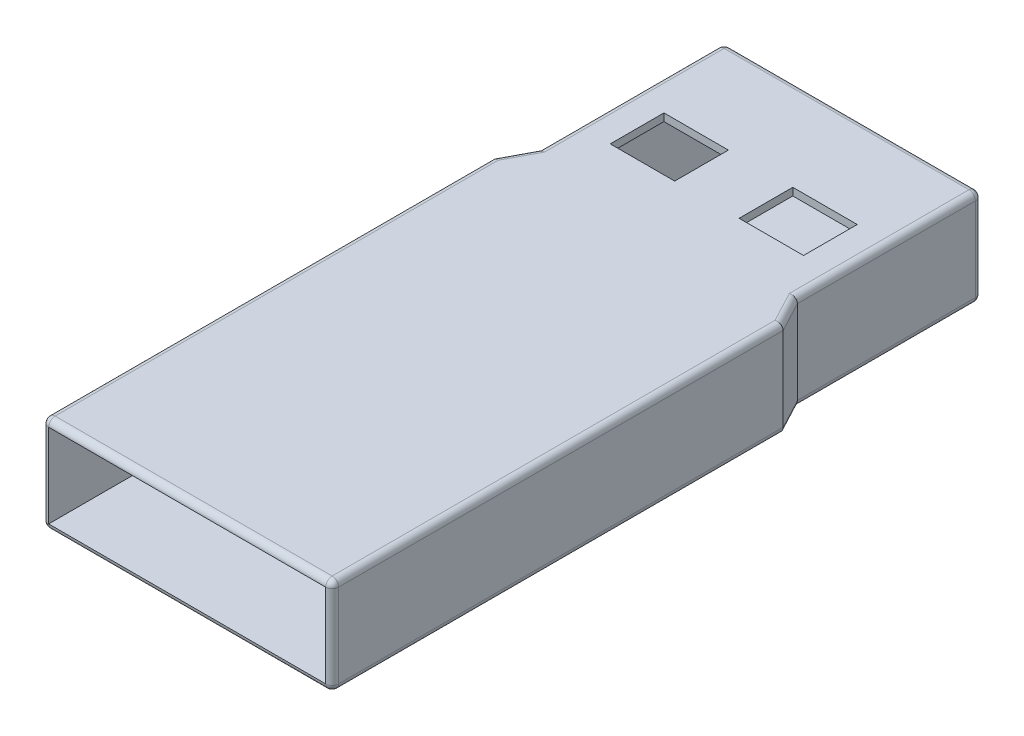
from build123d import *

# Parameters (mm, degrees)
BOSS_EXTRUDE1_DEPTH = 4.5
FILLET1_R           = 0.3
FILLET2_R           = 0.3
SHELL3_START        = 0.35
SHELL3_DEPTH        = 3.8
SKETCH3_W           = 12.9
SKETCH3_H           = 3.9
CUT_EXTRUDE1_DEPTH  = 21
CUT_EXTRUDE2_REACH  = 27.289
SKETCH4_W           = 3
SKETCH4_H           = 2.5


# Read off the part's stored shape, not the designer's step: Shell3
with BuildPart() as part:
    # Sketch1 → Boss-Extrude1 (new body)
    with BuildSketch(Plane(origin=(0, 0, 0), x_dir=(1, 0, 0), z_dir=(0, 1, 0))):
        Polygon((-6.75, -7.047619048), (6.75, -7.047619048), (6.75, 13.952380952), (6, 15.365710355), (6, 23.952380952), (-6, 23.952380952), (-6, 15.365710355), (-6.75, 13.952380952), align=None)
    extrude(amount=BOSS_EXTRUDE1_DEPTH)

    # Fillet1
    fillet1_edges = [part.edges().sort_by_distance(p)[0] for p in [
        (6, 4.5, -19.659045654),
        (6.375, 0, -14.659045654),
        (6.75, 0, -3.452380952),
        (0, 4.5, -23.952380952),
        (-6, 4.5, -19.659045654),
        (-6.375, 4.5, -14.659045654),
        (-6.75, 4.5, -3.452380952),
        (0, 4.5, 7.047619048),
        (6.75, 4.5, -3.452380952),
        (6.375, 4.5, -14.659045654),
        (0, 0, 7.047619048),
        (-6.75, 0, -3.452380952),
        (-6.375, 0, -14.659045654),
        (-6, 0, -19.659045654),
        (0, 0, -23.952380952),
        (6, 0, -19.659045654),
    ]]
    fillet(fillet1_edges, radius=FILLET1_R)

    # Fillet2
    # the kernel refuses this fillet: 0.3 mm, written as the material it takes off along each edge
    with BuildSketch(Plane(origin=(-6.45, 0.3, 6.747619048), x_dir=(-1, 0, 0), z_dir=(0, 0, 1))) as fillet2_piece_1_section:
        Polygon((0, 0), (FILLET2_R, 0), (FILLET2_R, FILLET2_R), (0, FILLET2_R), align=None)
    fillet2_piece_1 = extrude(amount=FILLET2_R, mode=Mode.PRIVATE)
    fillet2_piece_1 = fillet2_piece_1 - Plane(origin=(-6.45, 0.3, 6.747619048), x_dir=(0.7071067811865475, 0.7071067811865475, 0), z_dir=(0, 0, 1)) * Sphere(FILLET2_R, mode=Mode.PRIVATE)
    add(fillet2_piece_1, mode=Mode.SUBTRACT)
    with BuildSketch(Plane(origin=(-5.7, 0.3, -23.652380952), x_dir=(0, 0, -1), z_dir=(-1, 0, 0))) as fillet2_piece_2_section:
        Polygon((0, 0), (FILLET2_R, 0), (FILLET2_R, FILLET2_R), (0, FILLET2_R), align=None)
    fillet2_piece_2 = extrude(amount=FILLET2_R, mode=Mode.PRIVATE)
    fillet2_piece_2 = fillet2_piece_2 - Plane(origin=(-5.7, 0.3, -23.652380952), x_dir=(0, 0.7071067811865475, 0.7071067811865475), z_dir=(-1, 0, 0)) * Sphere(FILLET2_R, mode=Mode.PRIVATE)
    add(fillet2_piece_2, mode=Mode.SUBTRACT)
    with BuildSketch(Plane(origin=(6.45, 0.3, 6.747619048), x_dir=(1, 0, 0), z_dir=(0, 0, 1))) as fillet2_piece_3_section:
        Polygon((0, 0), (FILLET2_R, 0), (FILLET2_R, -FILLET2_R), (0, -FILLET2_R), align=None)
    fillet2_piece_3 = extrude(amount=FILLET2_R, mode=Mode.PRIVATE)
    fillet2_piece_3 = fillet2_piece_3 - Plane(origin=(6.45, 0.3, 6.747619048), x_dir=(-0.7071067811865475, 0.7071067811865475, 0), z_dir=(0, 0, 1)) * Sphere(FILLET2_R, mode=Mode.PRIVATE)
    add(fillet2_piece_3, mode=Mode.SUBTRACT)
    with BuildSketch(Plane(origin=(5.7, 0.3, -23.652380952), x_dir=(0, 0, -1), z_dir=(1, 0, 0))) as fillet2_piece_4_section:
        Polygon((0, 0), (FILLET2_R, 0), (FILLET2_R, -FILLET2_R), (0, -FILLET2_R), align=None)
    fillet2_piece_4 = extrude(amount=FILLET2_R, mode=Mode.PRIVATE)
    fillet2_piece_4 = fillet2_piece_4 - Plane(origin=(5.7, 0.3, -23.652380952), x_dir=(0, 0.7071067811865475, 0.7071067811865475), z_dir=(1, 0, 0)) * Sphere(FILLET2_R, mode=Mode.PRIVATE)
    add(fillet2_piece_4, mode=Mode.SUBTRACT)
    with BuildSketch(Plane(origin=(-5.7, 4.2, -23.652380952), x_dir=(0, 0, -1), z_dir=(-1, 0, 0))) as fillet2_piece_5_section:
        Polygon((0, 0), (FILLET2_R, 0), (FILLET2_R, -FILLET2_R), (0, -FILLET2_R), align=None)
    fillet2_piece_5 = extrude(amount=FILLET2_R, mode=Mode.PRIVATE)
    fillet2_piece_5 = fillet2_piece_5 - Plane(origin=(-5.7, 4.2, -23.652380952), x_dir=(0, -0.7071067811865475, 0.7071067811865475), z_dir=(-1, 0, 0)) * Sphere(FILLET2_R, mode=Mode.PRIVATE)
    add(fillet2_piece_5, mode=Mode.SUBTRACT)
    with BuildSketch(Plane(origin=(5.7, 4.2, -23.652380952), x_dir=(0, 0, -1), z_dir=(1, 0, 0))) as fillet2_piece_6_section:
        Polygon((0, 0), (FILLET2_R, 0), (FILLET2_R, FILLET2_R), (0, FILLET2_R), align=None)
    fillet2_piece_6 = extrude(amount=FILLET2_R, mode=Mode.PRIVATE)
    fillet2_piece_6 = fillet2_piece_6 - Plane(origin=(5.7, 4.2, -23.652380952), x_dir=(0, -0.7071067811865475, 0.7071067811865475), z_dir=(1, 0, 0)) * Sphere(FILLET2_R, mode=Mode.PRIVATE)
    add(fillet2_piece_6, mode=Mode.SUBTRACT)
    with BuildSketch(Plane(origin=(-6.45, 4.2, 6.747619048), x_dir=(-1, 0, 0), z_dir=(0, 0, 1))) as fillet2_piece_7_section:
        Polygon((0, 0), (FILLET2_R, 0), (FILLET2_R, -FILLET2_R), (0, -FILLET2_R), align=None)
    fillet2_piece_7 = extrude(amount=FILLET2_R, mode=Mode.PRIVATE)
    fillet2_piece_7 = fillet2_piece_7 - Plane(origin=(-6.45, 4.2, 6.747619048), x_dir=(0.7071067811865475, -0.7071067811865475, 0), z_dir=(0, 0, 1)) * Sphere(FILLET2_R, mode=Mode.PRIVATE)
    add(fillet2_piece_7, mode=Mode.SUBTRACT)
    with BuildSketch(Plane(origin=(6.45, 4.2, 6.747619048), x_dir=(1, 0, 0), z_dir=(0, 0, 1))) as fillet2_piece_8_section:
        Polygon((0, 0), (FILLET2_R, 0), (FILLET2_R, FILLET2_R), (0, FILLET2_R), align=None)
    fillet2_piece_8 = extrude(amount=FILLET2_R, mode=Mode.PRIVATE)
    fillet2_piece_8 = fillet2_piece_8 - Plane(origin=(6.45, 4.2, 6.747619048), x_dir=(-0.7071067811865475, -0.7071067811865475, 0), z_dir=(0, 0, 1)) * Sphere(FILLET2_R, mode=Mode.PRIVATE)
    add(fillet2_piece_8, mode=Mode.SUBTRACT)
    with BuildSketch(Plane(origin=(6, 0.3, -23.952380952), x_dir=(0, 0, 1), z_dir=(0, 1, 0)), Plane(origin=(6.75, 0.3, 7.047619048), x_dir=(-1, 0, 0), z_dir=(0, 1, 0))) as fillet2_piece_9:
        with BuildLine():
            CenterArc((FILLET2_R, -FILLET2_R), FILLET2_R, 90, 90)
            Line((0, -FILLET2_R), (0, 0))
            Line((0, 0), (FILLET2_R, 0))
        make_face()
    extrude(amount=3.9, mode=Mode.SUBTRACT)
    with BuildSketch(Plane(origin=(-6, 0.3, -23.952380952), x_dir=(0, 0, 1), z_dir=(0, 1, 0)), Plane(origin=(-6.75, 0.3, 7.047619048), x_dir=(1, 0, 0), z_dir=(0, 1, 0))) as fillet2_piece_10:
        with BuildLine():
            CenterArc((FILLET2_R, FILLET2_R), FILLET2_R, 180, 90)
            Line((0, FILLET2_R), (0, 0))
            Line((0, 0), (FILLET2_R, 0))
        make_face()
    extrude(amount=3.9, mode=Mode.SUBTRACT)

    # Shell3 outline → Shell3 (cut)
    with BuildSketch(Plane(origin=(0, 0, 0), x_dir=(1, 0, 0), z_dir=(0, 1, 0)).offset(SHELL3_START)):
        Polygon((6.4, -6.697619048), (6.4, 13.865268007), (5.65, 15.278597409), (5.65, 23.952380952), (-5.65, 23.952380952), (-5.65, 15.278597409), (-6.4, 13.865268007), (-6.4, -6.697619048), align=None)
    extrude(amount=SHELL3_DEPTH, mode=Mode.SUBTRACT)

    # Sketch3 → Cut-Extrude1 (cut)
    with BuildSketch(Plane.XY.offset(7.047619048)):
        with Locations((0, 2.25)):
            Rectangle(SKETCH3_W, SKETCH3_H)
    extrude(amount=-CUT_EXTRUDE1_DEPTH, mode=Mode.SUBTRACT)

    # Sketch4 → Cut-Extrude2 (cut, up to next)
    with BuildSketch(Plane(origin=(0, 4.5, 0), x_dir=(1, 0, 0), z_dir=(0, 1, 0)), mode=Mode.PRIVATE) as cut_extrude2_sk1:
        with Locations((3, 18.402380952)):
            Rectangle(SKETCH4_W, SKETCH4_H)
    cut_extrude2_tool1 = extrude(cut_extrude2_sk1.sketch, amount=-CUT_EXTRUDE2_REACH, mode=Mode.PRIVATE) & part.part
    # Sketch4 → Cut-Extrude2 (cut, up to next)
    with BuildSketch(Plane(origin=(0, 4.5, 0), x_dir=(1, 0, 0), z_dir=(0, 1, 0)), mode=Mode.PRIVATE) as cut_extrude2_sk2:
        with Locations((-3, 18.402380952)):
            Rectangle(SKETCH4_W, SKETCH4_H)
    cut_extrude2_tool2 = extrude(cut_extrude2_sk2.sketch, amount=-CUT_EXTRUDE2_REACH, mode=Mode.PRIVATE) & part.part
    add(cut_extrude2_tool1.solids().sort_by_distance((3, 4.5, -18.402381))[0], mode=Mode.SUBTRACT)
    add(cut_extrude2_tool2.solids().sort_by_distance((-3, 4.5, -18.402381))[0], mode=Mode.SUBTRACT)


solid = part.part
